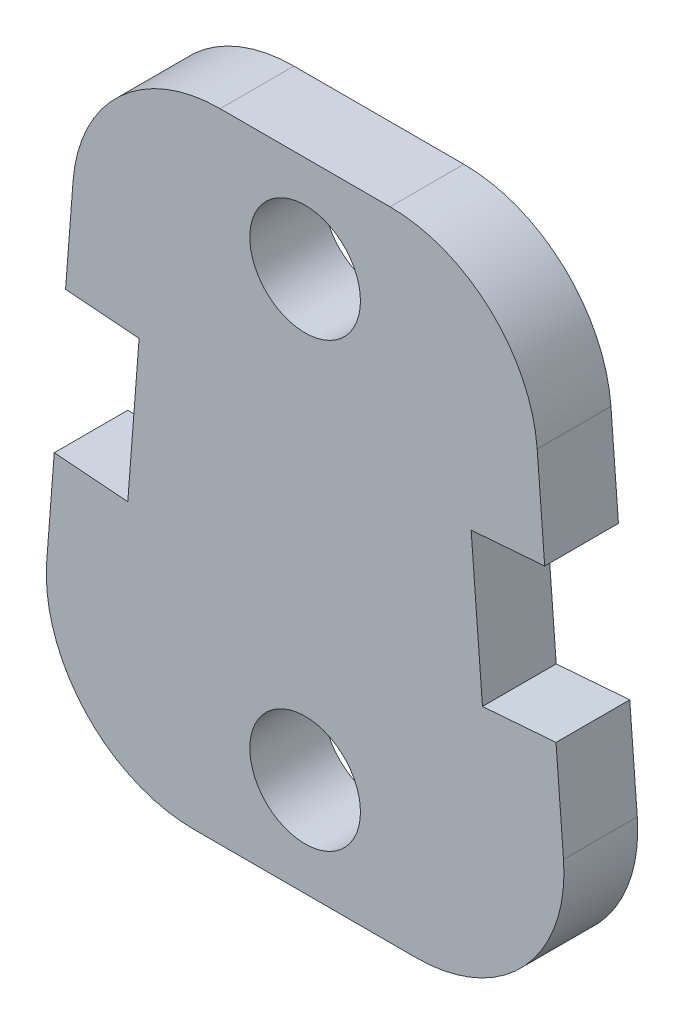
from build123d import *

# Parameters (mm, degrees)
BOSS_EXTRUDE1_DEPTH = 3.175
CAVITY1_DEPTH       = 3.175


# Read off the part's stored shape, not the designer's step: Cavity1
with BuildPart() as part:
    # Sketch1 → Boss-Extrude1 (new body)
    with BuildSketch(Plane.XY):
        with BuildLine():
            Line((0, 80.613250085), (0, 82.380666667))
            Line((0, 82.380666667), (-3.657727907, 82.380666667))
            ThreePointArc((-3.657727907, 82.380666667), (-7.972232828, 80.689802562), (-9.98902389, 76.517689435))
            Line((-9.98902389, 76.517689435), (-11.122254659, 61.785689435))
            ThreePointArc((-11.122254659, 61.785689435), (-9.450094571, 56.984161746), (-4.790958676, 54.948666667))
            Line((-4.790958676, 54.948666667), (0, 54.948666667))
            Line((0, 54.948666667), (0, 56.800750085))
            ThreePointArc((0, 56.800750085), (-2.38125, 59.182000085), (0, 61.563250085))
            Line((0, 61.563250085), (0, 75.850750085))
            ThreePointArc((0, 75.850750085), (-2.38125, 78.232000085), (0, 80.613250085))
        make_face()
        with BuildLine():
            Line((11.122254659, 61.785689435), (9.98902389, 76.517689435))
            ThreePointArc((9.98902389, 76.517689435), (7.972232828, 80.689802562), (3.657727907, 82.380666667))
            Line((3.657727907, 82.380666667), (0, 82.380666667))
            Line((0, 82.380666667), (0, 80.613250085))
            ThreePointArc((0, 80.613250085), (1.683798023, 79.915798107), (2.38125, 78.232000085))
            ThreePointArc((2.38125, 78.232000085), (1.683798023, 76.548202062), (0, 75.850750085))
            Line((0, 75.850750085), (0, 61.563250085))
            ThreePointArc((0, 61.563250085), (1.683798023, 60.865798107), (2.38125, 59.182000085))
            ThreePointArc((2.38125, 59.182000085), (1.683798023, 57.498202062), (0, 56.800750085))
            Line((0, 56.800750085), (0, 54.948666667))
            Line((0, 54.948666667), (4.790958676, 54.948666667))
            ThreePointArc((4.790958676, 54.948666667), (9.450094571, 56.984161746), (11.122254659, 61.785689435))
        make_face()
    extrude(amount=BOSS_EXTRUDE1_DEPTH)

    # Cavity1 outline → Cavity1 (cut)
    with BuildSketch(Plane.XY):
        Polygon((-7.633502667, 65.742530059), (-7.146479899, 72.073826042), (-10.31212789, 72.317337426), (-10.799150658, 65.986041443), align=None)
        Polygon((10.31212789, 72.317337426), (7.146479899, 72.073826042), (7.633502667, 65.742530059), (10.799150658, 65.986041443), align=None)
    extrude(amount=CAVITY1_DEPTH, mode=Mode.SUBTRACT)


solid = part.part
